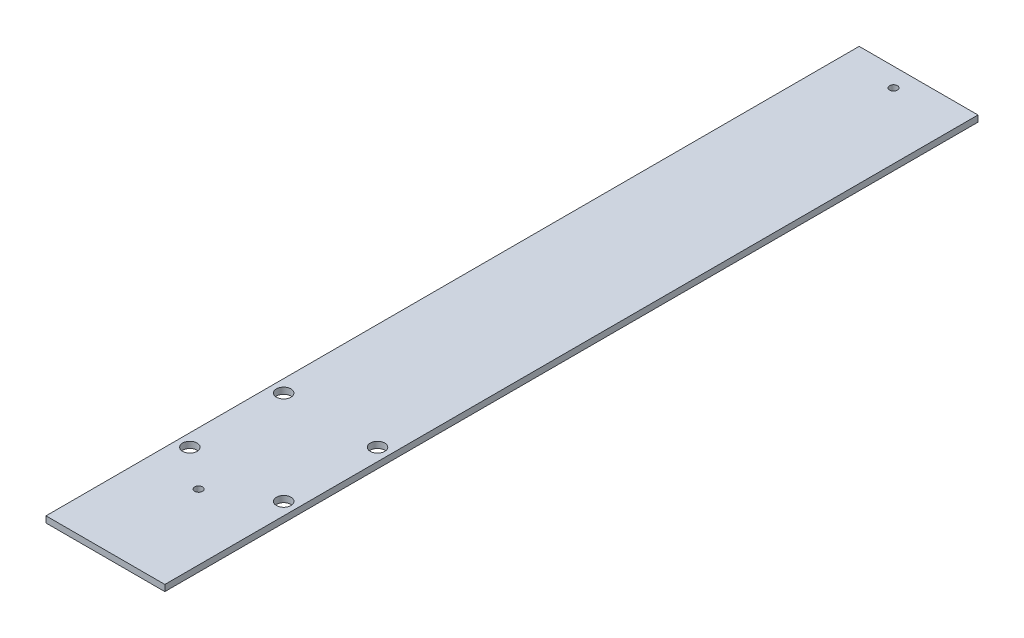
from build123d import *

# Parameters (mm, degrees)
SKETCH1_W               = 241.3
SKETCH1_H               = 1651
BOSS_EXTRUDE1_DEPTH     = 12.7
CUT_EXTRUDE1_DEPTH      = 1669.588619163
CUT_EXTRUDE1_DEPTH_BACK = 1669.588619163
SKETCH2_R               = 7.9375
SKETCH3_R               = 14.72946
CUT_EXTRUDE2_DEPTH      = 1669.588619163


with BuildPart() as part:
    # Sketch1 → Boss-Extrude1 (new body)
    with BuildSketch(Plane(origin=(0, 0, 0), x_dir=(1, 0, 0), z_dir=(0, 1, 0))):
        with Locations((120.65, -825.5)):
            Rectangle(SKETCH1_W, SKETCH1_H)
    extrude(amount=BOSS_EXTRUDE1_DEPTH)

    # Sketch2 → Cut-Extrude1 (cut, two sides: drawn at the far end of the back side and taken through both)
    with BuildSketch(Plane(origin=(0, 12.7, 0), x_dir=(1, 0, 0), z_dir=(0, 1, 0)).offset(-CUT_EXTRUDE1_DEPTH_BACK)):
        with Locations((107.95, -38.1)):
            Circle(SKETCH2_R)
        with Locations((107.95, -1449.0573)):
            Circle(SKETCH2_R)
    extrude(amount=CUT_EXTRUDE1_DEPTH + CUT_EXTRUDE1_DEPTH_BACK, mode=Mode.SUBTRACT)

    # Sketch3 → Cut-Extrude2 (cut, through all)
    with BuildSketch(Plane.XZ):
        with Locations((215.9, 1193.8)):
            Circle(SKETCH3_R)
        with Locations((25.4, 1193.8)):
            Circle(SKETCH3_R)
        with Locations((25.4, 1384.3)):
            Circle(SKETCH3_R)
        with Locations((215.9, 1384.3)):
            Circle(SKETCH3_R)
    extrude(amount=-CUT_EXTRUDE2_DEPTH, mode=Mode.SUBTRACT)


solid = part.part
